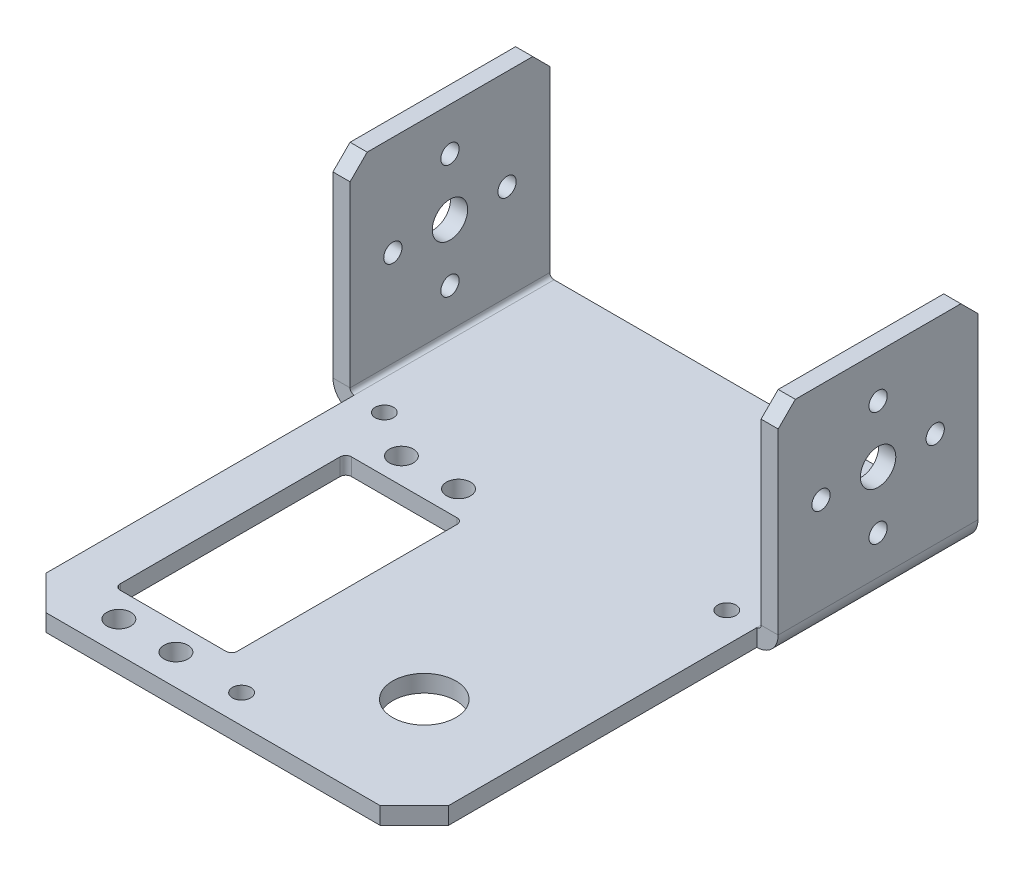
from build123d import *

# Parameters (mm, degrees)
SM_BASE_FLANGE_1_DEPTH      = 35
SKETCH_7_W                  = 70.5268
SKETCH_7_H                  = 3
EXTRUDE_1_DEPTH             = 60
SKETCH_8_R                  = 3.1
CUT_EXTRUDE_1_DEPTH         = 128.804538261
SKETCH_9_R                  = 1.6
CUT_EXTRUDE_2_DEPTH         = 128.804538261
PATTERN_CIRCULAR_1_COUNT    = 4
SKETCH_10_W                 = 20.5
SKETCH_10_H                 = 40.5
CUT_EXTRUDE_3_DEPTH         = 110.498858442
SKETCH_11_R                 = 2.1
CUT_EXTRUDE_4_DEPTH         = 110.498858442
PATTERN_LINEAR_1_COUNT      = 2
PATTERN_LINEAR_1_PITCH      = 10
PATTERN_LINEAR_1_COUNT_DIR2 = 2
PATTERN_LINEAR_1_PITCH_DIR2 = 49.5
SKETCH_14_R                 = 5.55
CUT_EXTRUDE_7_DEPTH         = 109.494239478
FILLET_1_R                  = 1
CHAMFER_4_SIZE              = 3
CHAMFER_5_SIZE              = 6
SKETCH_15_R                 = 1.6
CUT_EXTRUDE_8_DEPTH         = 110.498858442
SKETCH_16_R                 = 1.6
CUT_EXTRUDE_9_DEPTH         = 110.498858442
PATTERN_LINEAR_2_COUNT      = 2
PATTERN_LINEAR_2_PITCH      = 60


# Sheet-metal steps are written as plain solids
with BuildPart() as part:
    # Sketch 2 → 基材-凸緣1 (new body)
    with BuildSketch(Plane.XY):
        with BuildLine():
            Line((36, 35), (36, 0.7366))
            ThreePointArc((36, 0.7366), (35.784254855, 0.215745145), (35.2634, 0))
            Line((35.2634, 0), (-35.2634, 0))
            ThreePointArc((-35.2634, 0), (-35.784254855, 0.215745145), (-36, 0.7366))
            Line((-36, 0.7366), (-36, 35))
            Line((-36, 35), (-39, 35))
            Line((-39, 35), (-39, 0.7366))
            ThreePointArc((-39, 0.7366), (-37.905575199, -1.905575199), (-35.2634, -3))
            Line((-35.2634, -3), (35.2634, -3))
            ThreePointArc((35.2634, -3), (37.905575199, -1.905575199), (39, 0.7366))
            Line((39, 0.7366), (39, 35))
            Line((39, 35), (36, 35))
        make_face()
    extrude(amount=SM_BASE_FLANGE_1_DEPTH)

    # 草圖7 → 填料-伸長1 (add)
    with BuildSketch(Plane.XY.offset(35)):
        with Locations((0, -1.5)):
            Rectangle(SKETCH_7_W, SKETCH_7_H)
    extrude(amount=EXTRUDE_1_DEPTH)

    # 草圖8 → 除料-伸長1 (cut, through all)
    with BuildSketch(Plane(origin=(39, 0, 0), x_dir=(0, 0, -1), z_dir=(1, 0, 0))):
        with Locations(Location((-17.5, 17.5, 0), (0, 0, 90))):
            Circle(SKETCH_8_R)
    extrude(amount=-CUT_EXTRUDE_1_DEPTH, mode=Mode.SUBTRACT)

    # 草圖9 → 除料-伸長2 (cut, through all)
    with BuildSketch(Plane.ZY.offset(39)):
        with Locations((17.5, 7.5)):
            Circle(SKETCH_9_R)
    cut_extrude_2 = extrude(amount=-CUT_EXTRUDE_2_DEPTH, mode=Mode.SUBTRACT)

    # 環狀複製排列1: 除料-伸長2 ×4 about axis
    pattern_circular_1_axis = Axis((0, 17.5, 17.5), (1, 0, 0))
    for i in range(1, PATTERN_CIRCULAR_1_COUNT):
        add(cut_extrude_2.rotate(pattern_circular_1_axis, i * 360 / PATTERN_CIRCULAR_1_COUNT), mode=Mode.SUBTRACT)

    # 草圖10 → 除料-伸長3 (cut, through all)
    with BuildSketch(Plane.XZ.offset(3)):
        with Locations((-16.9, 64.85)):
            Rectangle(SKETCH_10_W, SKETCH_10_H)
    extrude(amount=-CUT_EXTRUDE_3_DEPTH, mode=Mode.SUBTRACT)

    # 草圖11 → 除料-伸長4 (cut, through all)
    with BuildSketch(Plane.XZ.offset(3)):
        with Locations((-21.9, 89.6)):
            Circle(SKETCH_11_R)
    cut_extrude_4 = extrude(amount=-CUT_EXTRUDE_4_DEPTH, mode=Mode.SUBTRACT)

    # 直線複製排列1: Cut-Extrude 4 2 × 2
    with Locations(*[(i * PATTERN_LINEAR_1_PITCH, 0, -j * PATTERN_LINEAR_1_PITCH_DIR2) for i in range(PATTERN_LINEAR_1_COUNT) for j in range(PATTERN_LINEAR_1_COUNT_DIR2) if (i, j) != (0, 0)]):
        add(cut_extrude_4, mode=Mode.SUBTRACT)

    # 草圖14 → 除料-伸長7 (cut, through all)
    with BuildSketch(Plane(origin=(0, 0, 0), x_dir=(1, 0, 0), z_dir=(0, 1, 0))):
        with Locations(Location((17.0034, -75, 0), (0, 0, 180))):
            Circle(SKETCH_14_R)
    extrude(amount=-CUT_EXTRUDE_7_DEPTH, mode=Mode.SUBTRACT)

    # 圓角1
    fillet_1_edges = [part.edges().sort_by_distance(p)[0] for p in [
        (-6.65, -1.5, 85.1),
        (-6.65, -1.5, 44.6),
        (-27.15, -1.5, 44.6),
        (-27.15, -1.5, 85.1),
    ]]
    fillet(fillet_1_edges, radius=FILLET_1_R)

    # 導角4
    chamfer_4_edges = [part.edges().sort_by_distance(p)[0] for p in [
        (-37.5, 35, 0),
        (37.5, 35, 0),
        (-37.5, 35, 35),
        (37.5, 35, 35),
    ]]
    chamfer(chamfer_4_edges, length=CHAMFER_4_SIZE)

    # 導角5
    chamfer_5_edges = [part.edges().sort_by_distance(p)[0] for p in [
        (35.2634, -1.5, 95),
        (-35.2634, -1.5, 95),
    ]]
    chamfer(chamfer_5_edges, length=CHAMFER_5_SIZE)

    # 草圖15 → 除料-伸長8 (cut, through all)
    with BuildSketch(Plane.XZ.offset(3)):
        with Locations((0, 90)):
            Circle(SKETCH_15_R)
    extrude(amount=-CUT_EXTRUDE_8_DEPTH, mode=Mode.SUBTRACT)

    # 草圖16 → 除料-伸長9 (cut, through all)
    with BuildSketch(Plane.XZ.offset(3)):
        with Locations((30, 35)):
            Circle(SKETCH_16_R)
    cut_extrude_9 = extrude(amount=-CUT_EXTRUDE_9_DEPTH, mode=Mode.SUBTRACT)

    # 直線複製排列2: 除料-伸長9 ×2
    with Locations(*[(-i * PATTERN_LINEAR_2_PITCH, 0, 0) for i in range(1, PATTERN_LINEAR_2_COUNT)]):
        add(cut_extrude_9, mode=Mode.SUBTRACT)


solid = part.part
